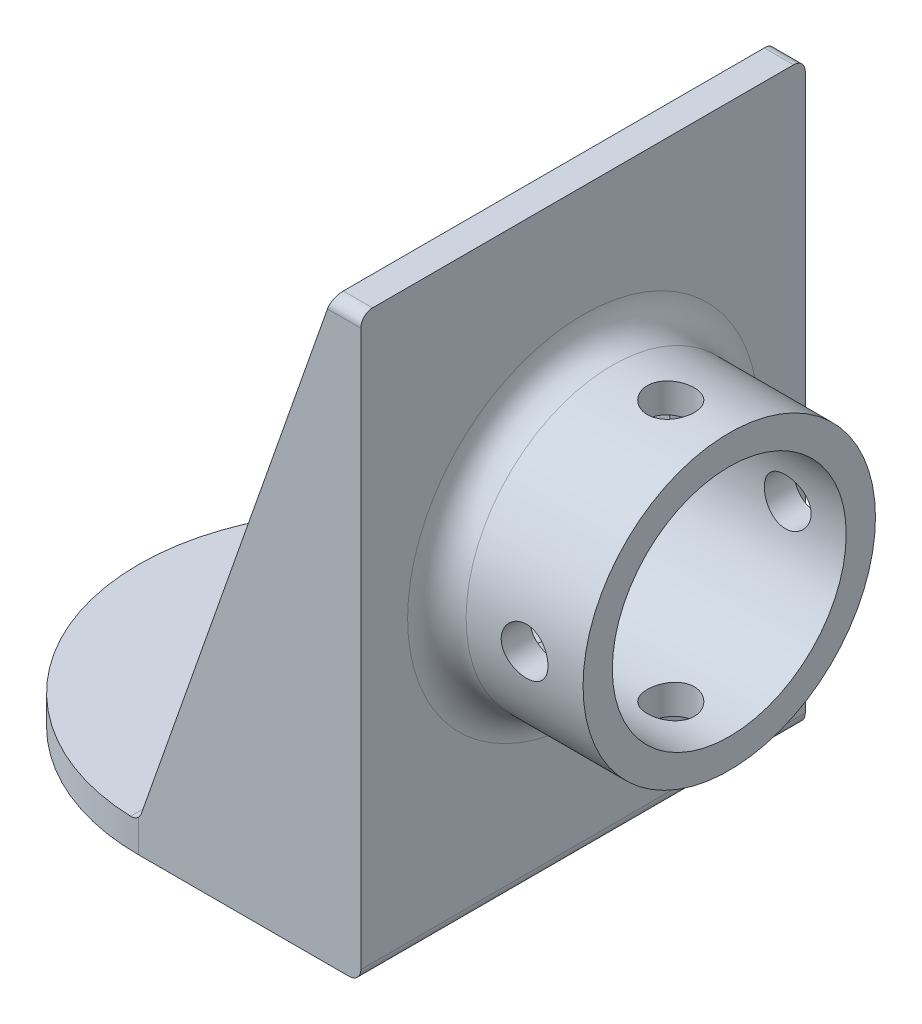
from build123d import *

# Parameters (mm, degrees)
EXTRUDE_1_DEPTH     = 76
FILLET_1_R          = 38
RIB_1_REACH         = 148.127
SKETCH_4_WALL_W     = 393.877609006
SKETCH_4_WALL_H     = 5
RIB_START           = -5
RIB_2_DEPTH         = 5
SKETCH_7_R          = 2.5
CUT_EXTRUDE_1_DEPTH = 10
FILLET_2_R          = 2
CHAMFER_1_SIZE      = 10
CHAMFER_1_SIZE2     = 5
FILLET_3_R          = 2
FILLET_4_R          = 2
SKETCH_8_R          = 20
CUT_EXTRUDE_2_DEPTH = 5
EXTRUDE_START       = 25
SKETCH_8_6_R        = 25
SKETCH_8_6_R_2      = 20
EXTRUDE_4_DEPTH     = 25
FILLET_5_R          = 5
SKETCH_13_R         = 4
CUT_EXTRUDE_3_DEPTH = 76
SKETCH_14_R         = 4
CUT_EXTRUDE_4_DEPTH = 76


# Read off the part's stored shape, not the designer's step: Ребро2
with BuildPart() as part:
    # Эскиз3 → Бобышка-Вытянуть1 (new body)
    with BuildSketch(Plane.XY):
        Polygon((76, 0), (0, 0), (0, 5), (71, 5), (71, 99), (76, 99), align=None)
    extrude(amount=EXTRUDE_1_DEPTH)

    # Скругление1
    fillet_1_edges = [part.edges().sort_by_distance(p)[0] for p in [
        (0, 2.5, 0),
        (0, 2.5, 76),
    ]]
    fillet(fillet_1_edges, radius=FILLET_1_R - 0.0001)  # a hair under: the kernel refuses the full size

    # Эскиз4 wall → Ребро1 (add, up to next)
    with BuildSketch(Plane(origin=(54.5, 52, 76), x_dir=(-0.331244504731, -0.94354495287, 0), z_dir=(0.94354495287, -0.331244504731, 0)), mode=Mode.PRIVATE) as rib_1_sk1:
        with Locations((0, 2.5)):
            Rectangle(SKETCH_4_WALL_W, SKETCH_4_WALL_H)
    rib_1_tool1 = extrude(rib_1_sk1.sketch, amount=RIB_1_REACH, mode=Mode.PRIVATE) - part.part
    add(rib_1_tool1.solids().sort_by_distance((54.5, 52, 76))[0])

    # Ребро2 outline → Ребро2 (add)
    with BuildSketch(Plane(origin=(0, 0, 0), x_dir=(-1, 0, 0), z_dir=(0, 0, -1)).offset(RIB_START)):
        Polygon((-38, 5), (-71, 99), (-71, 5), align=None)
    extrude(amount=RIB_2_DEPTH)

    # Эскиз7 → Вырез-Вытянуть1 (cut)
    with BuildSketch(Plane(origin=(0, 5, 0), x_dir=(1, 0, 0), z_dir=(0, 1, 0))):
        with Locations(Location((20, -38, 0), (0, 0, 180))):
            Circle(SKETCH_7_R)
        with Locations(Location((29, -22.411542732, 0), (0, 0, 180))):
            Circle(SKETCH_7_R)
        with Locations(Location((47, -22.411542732, 0), (0, 0, 180))):
            Circle(SKETCH_7_R)
        with Locations(Location((56, -38, 0), (0, 0, 180))):
            Circle(SKETCH_7_R)
        with Locations(Location((47, -53.588457268, 0), (0, 0, 180))):
            Circle(SKETCH_7_R)
        with Locations(Location((29, -53.588457268, 0), (0, 0, 180))):
            Circle(SKETCH_7_R)
    extrude(amount=-CUT_EXTRUDE_1_DEPTH, mode=Mode.SUBTRACT)

    # Скругление2
    fillet_2_edges = [part.edges().sort_by_distance(p)[0] for p in [
        (76, 0, 38),
    ]]
    fillet(fillet_2_edges, radius=FILLET_2_R)

    # Фаска1
    chamfer_1_edges = [part.edges().sort_by_distance(p)[0] for p in [
        (71, 5, 38),
    ]]
    chamfer_1_side = [part.faces().sort_by_distance(p)[0] for p in [
        (71, 52, 38),
    ]]
    chamfer(chamfer_1_edges, length=CHAMFER_1_SIZE, length2=CHAMFER_1_SIZE2, reference=chamfer_1_side[0])

    # Скругление3
    fillet_3_edges = [part.edges().sort_by_distance(p)[0] for p in [
        (38, 5, 73.5),
        (38, 5, 2.5),
    ]]
    fillet(fillet_3_edges, radius=FILLET_3_R)

    # Скругление4
    fillet_4_edges = [part.edges().sort_by_distance(p)[0] for p in [
        (73.5, 99, 76),
        (73.5, 99, 0),
    ]]
    fillet(fillet_4_edges, radius=FILLET_4_R)

    # Эскиз8 → Вырез-Вытянуть2 (cut)
    with BuildSketch(Plane(origin=(76, 0, 0), x_dir=(0, 0, -1), z_dir=(1, 0, 0))):
        with Locations((-38, 50)):
            Circle(SKETCH_8_R)
    extrude(amount=-CUT_EXTRUDE_2_DEPTH, mode=Mode.SUBTRACT)

    # Эскиз8<6> → Бобышка-Вытянуть4 (add)
    with BuildSketch(Plane(origin=(76, 0, 0), x_dir=(0, 0, -1), z_dir=(1, 0, 0)).offset(EXTRUDE_START)):
        with Locations(Location((-38, 50, 0), (0, 0, 180))):
            Circle(SKETCH_8_6_R)
        with Locations((-38, 50)):
            Circle(SKETCH_8_6_R_2, mode=Mode.SUBTRACT)
    extrude(amount=-EXTRUDE_4_DEPTH)

    # Скругление5
    fillet_5_edges = [part.edges().sort_by_distance(p)[0] for p in [
        (76, 50, 13),
    ]]
    fillet(fillet_5_edges, radius=FILLET_5_R)

    # Эскиз13 → Вырез-Вытянуть3 (cut)
    with BuildSketch(Plane(origin=(0, 0, 0), x_dir=(-1, 0, 0), z_dir=(0, 0, -1))):
        with Locations((-91, 50)):
            Circle(SKETCH_13_R)
    extrude(amount=-CUT_EXTRUDE_3_DEPTH, mode=Mode.SUBTRACT)

    # Эскиз14 → Вырез-Вытянуть4 (cut)
    with BuildSketch(Plane(origin=(0, 99, 0), x_dir=(1, 0, 0), z_dir=(0, 1, 0))):
        with Locations(Location((91, -38, 0), (0, 0, 270))):
            Circle(SKETCH_14_R)
    extrude(amount=-CUT_EXTRUDE_4_DEPTH, mode=Mode.SUBTRACT)


solid = part.part
